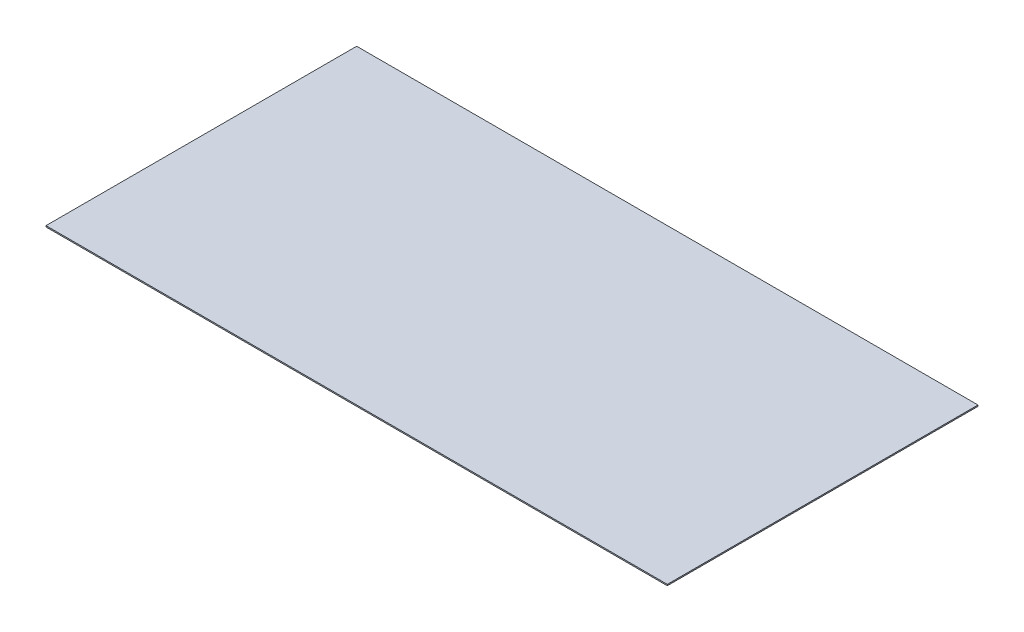
from build123d import *

# Parameters (mm, degrees)
SKETCH1_W           = 2000
SKETCH1_H           = 1000
BOSS_EXTRUDE1_DEPTH = 4


with BuildPart() as part:
    # Sketch1 → Boss-Extrude1 (new body)
    with BuildSketch(Plane(origin=(0, 0, 0), x_dir=(1, 0, 0), z_dir=(0, 1, 0))):
        Rectangle(SKETCH1_W, SKETCH1_H)
    extrude(amount=BOSS_EXTRUDE1_DEPTH)


solid = part.part
